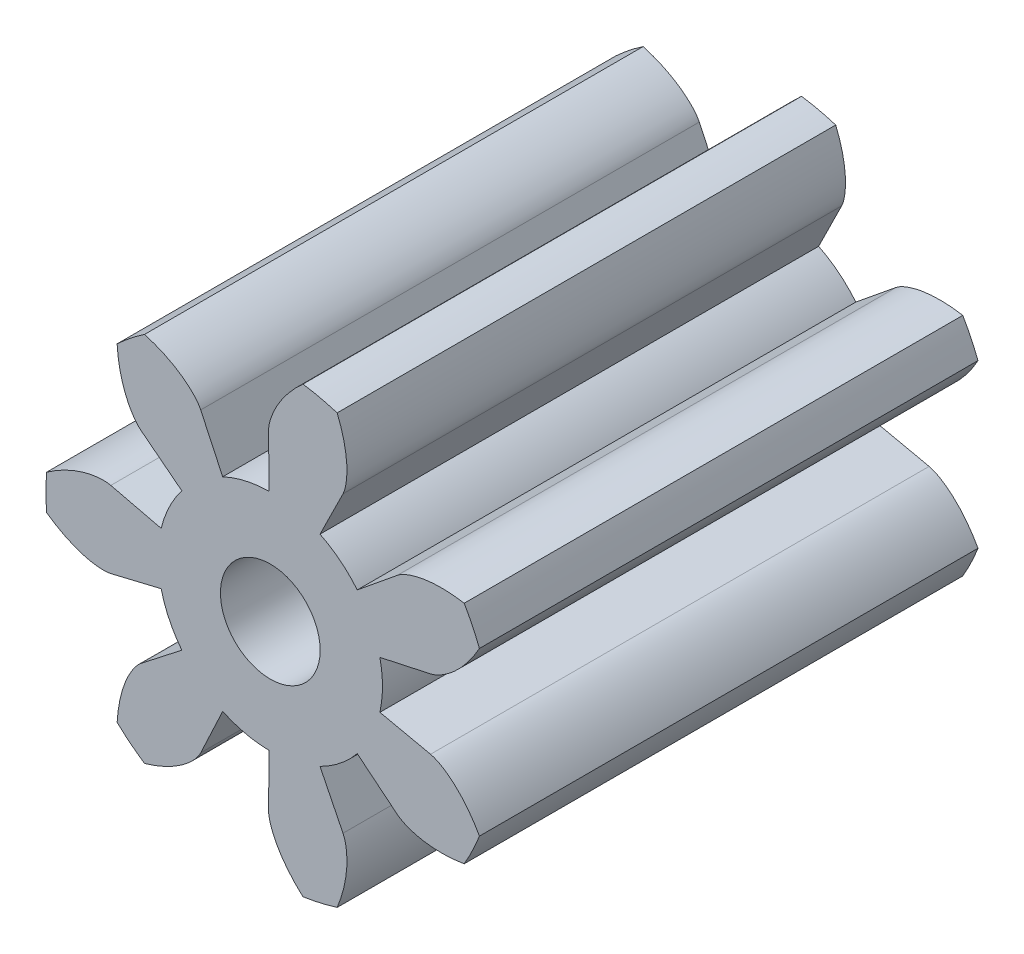
from build123d import *

# Parameters (mm, degrees)
SKETCH_1_R               = 2.25
SKETCH_1_R_2             = 0.5
EXTRUDE_1_DEPTH          = 5
CUT_EXTRUDE_1_DEPTH      = 6.926634796
PATTERN_CIRCULAR_1_COUNT = 7
PATTERN_CIRCULAR_1_ANGLE = 308.571428571


with BuildPart() as part:
    # 草图1 → 凸台-拉伸1 (new body)
    with BuildSketch(Plane.XY):
        Circle(SKETCH_1_R)
        Circle(SKETCH_1_R_2, mode=Mode.SUBTRACT)
    extrude(amount=EXTRUDE_1_DEPTH)

    # 草图1<3> → 切除-拉伸1 (cut, through all)
    with BuildSketch(Plane.XY):
        with BuildLine():
            Line((1.60703087, 0.348865787), (1.09939277, 0.238664068))
            ThreePointArc((1.09939277, 0.238664068), (1.118579873, 0.120016944), (1.125, 0))
            ThreePointArc((1.125, 0), (1.118579873, -0.120016944), (1.09939277, -0.238664068))
            Line((1.09939277, -0.238664068), (1.60703087, -0.348865787))
            add(Edge.make_bspline(
                [(1.60703087, -0.348865787), (1.619279345, -0.351524774), (1.652887648, -0.361597567), (1.713579338, -0.390587488), (1.804537483, -0.450699135), (1.909087627, -0.54608985), (1.997096837, -0.652937312), (2.055551724, -0.741830038), (2.087709526, -0.797582019), (2.097267985, -0.814841701)],
                knots=[0, 0, 0, 0, 0, 0.005604068, 0.015718248, 0.029959916, 0.048733667, 0.068727063, 0.077567055, 0.077567055, 0.077567055, 0.077567055, 0.077567055], degree=4))
            ThreePointArc((2.097267985, -0.814841701), (2.211487392, -0.414516003), (2.25, 0))
            ThreePointArc((2.25, 0), (2.211487392, 0.414516003), (2.097267985, 0.814841701))
            add(Edge.make_bspline(
                [(1.60703087, 0.348865787), (1.619279345, 0.351524774), (1.652887648, 0.361597567), (1.713579338, 0.390587488), (1.804537483, 0.450699135), (1.909087627, 0.54608985), (1.997096837, 0.652937312), (2.055551724, 0.741830038), (2.087709526, 0.797582019), (2.097267985, 0.814841701)],
                knots=[0, 0, 0, 0, 0, 0.005604068, 0.015718248, 0.029959916, 0.048733667, 0.068727063, 0.077567055, 0.077567055, 0.077567055, 0.077567055, 0.077567055], degree=4))
        make_face()
    cut_extrude_1 = extrude(amount=CUT_EXTRUDE_1_DEPTH, mode=Mode.SUBTRACT)

    # 阵列(圆周)1: 切除-拉伸1 ×7 about axis
    pattern_circular_1_axis = Axis((0, 0, 5), (0, 0, 1))
    for i in range(1, PATTERN_CIRCULAR_1_COUNT):
        add(cut_extrude_1.rotate(pattern_circular_1_axis, i * PATTERN_CIRCULAR_1_ANGLE / (PATTERN_CIRCULAR_1_COUNT - 1)), mode=Mode.SUBTRACT)


solid = part.part
